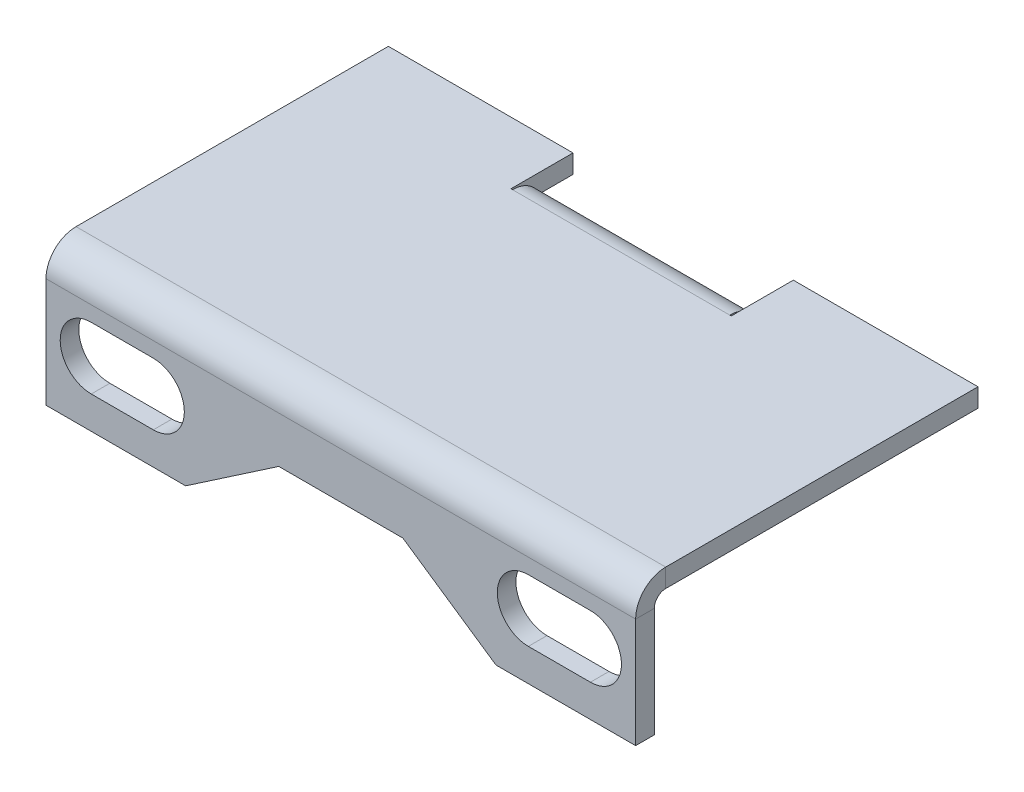
from build123d import *

# Parameters (mm, degrees)
BRIDA_BASE1_DEPTH                = 1.2
BRIDA_DE_ARISTA1_STRIP_W         = 6.2732
BRIDA_DE_ARISTA1_STRIP_H         = 1.2
BRIDA_DE_ARISTA1_STRIP_CUT_DEPTH = 38
BRIDA_DE_ARISTA1_DEPTH           = 38
BRIDA_DE_ARISTA2_STRIP_W         = 6.2732
BRIDA_DE_ARISTA2_STRIP_H         = 1.2
BRIDA_DE_ARISTA2_STRIP_CUT_DEPTH = 38
BRIDA_DE_ARISTA2_DEPTH           = 38
DESDOBLAR1_START                 = -19
DESDOBLAR1_DEPTH                 = 38
DESDOBLAR1_2_DEPTH               = 38
CROQUIS14_W                      = 12
CROQUIS14_H                      = 6.162926371
CORTAR_EXTRUIR1_DEPTH            = 1.2
DOBLAR1_START                    = -19
DOBLAR1_DEPTH                    = 38
DOBLAR1_2_DEPTH                  = 38
DOBLAR1_START_2                  = -7
DOBLAR1_3_DEPTH                  = 14
CROQUIS16_W                      = 11.9
CROQUIS16_H                      = 4
SALIENTE_EXTRUIR1_DEPTH          = 1.2


# Read off the part's stored shape, not the designer's step: Desdoblar1, Doblar1
# Sheet-metal steps are written as plain solids
with BuildPart() as part:
    # Croquis1 → Brida base1 (new body)
    with BuildSketch(Plane.XY):
        Polygon((-19, 19), (19, 19), (19, 10), (10, 10), (4, 14.085), (-4, 14.085), (-10, 10), (-19, 10), align=None)
        with BuildLine():
            Line((-16.085, 16.085), (-12.085, 16.085))
            ThreePointArc((-12.085, 16.085), (-10.085, 14.085), (-12.085, 12.085))
            Line((-12.085, 12.085), (-16.085, 12.085))
            ThreePointArc((-16.085, 12.085), (-18.085, 14.085), (-16.085, 16.085))
        make_face(mode=Mode.SUBTRACT)
        with BuildLine():
            Line((12.085, 16.085), (16.085, 16.085))
            ThreePointArc((16.085, 16.085), (18.085, 14.085), (16.085, 12.085))
            Line((16.085, 12.085), (12.085, 12.085))
            ThreePointArc((12.085, 12.085), (10.085, 14.085), (12.085, 16.085))
        make_face(mode=Mode.SUBTRACT)
    extrude(amount=-BRIDA_BASE1_DEPTH)

    # Brida de arista1 strip (across the edge) → Brida de arista1 strip cut (cut)
    with BuildSketch(Plane(origin=(-19, 19, -1.2), x_dir=(0, -1, 0), z_dir=(1, 0, 0))):
        with Locations((-1.2, -0.6)):
            Rectangle(BRIDA_DE_ARISTA1_STRIP_W, BRIDA_DE_ARISTA1_STRIP_H)
    extrude(amount=BRIDA_DE_ARISTA1_STRIP_CUT_DEPTH, mode=Mode.SUBTRACT)

    # Brida de arista1 section (across the edge) → Brida de arista1 (add)
    with BuildSketch(Plane(origin=(-19, 19, -1.2), x_dir=(0, -1, 0), z_dir=(1, 0, 0))):
        with BuildLine():
            Line((0, 0.7366), (0, 18.8))
            Line((0, 18.8), (1.2, 18.8))
            Line((1.2, 18.8), (1.2, 0.7366))
            ThreePointArc((1.2, 0.7366), (1.415745145, 0.215745145), (1.9366, 0))
            Line((1.9366, 0), (1.9366, -1.2))
            ThreePointArc((1.9366, -1.2), (0.567217008, -0.632782992), (0, 0.7366))
        make_face()
    extrude(amount=BRIDA_DE_ARISTA1_DEPTH)

    # Brida de arista2 strip (across the edge) → Brida de arista2 strip cut (cut)
    with BuildSketch(Plane(origin=(-19, 17.8, -20), x_dir=(0, 0, 1), z_dir=(1, 0, 0))):
        with Locations((-1.2, -0.6)):
            Rectangle(BRIDA_DE_ARISTA2_STRIP_W, BRIDA_DE_ARISTA2_STRIP_H)
    extrude(amount=BRIDA_DE_ARISTA2_STRIP_CUT_DEPTH, mode=Mode.SUBTRACT)

    # Brida de arista2 section (across the edge) → Brida de arista2 (add)
    with BuildSketch(Plane(origin=(-19, 17.8, -20), x_dir=(0, 0, 1), z_dir=(1, 0, 0))):
        with BuildLine():
            Line((0, 0.7366), (0, 4.8))
            Line((0, 4.8), (1.2, 4.8))
            Line((1.2, 4.8), (1.2, 0.7366))
            ThreePointArc((1.2, 0.7366), (1.415745145, 0.215745145), (1.9366, 0))
            Line((1.9366, 0), (1.9366, -1.2))
            ThreePointArc((1.9366, -1.2), (0.567217008, -0.632782992), (0, 0.7366))
        make_face()
    extrude(amount=BRIDA_DE_ARISTA2_DEPTH)

    # Desdoblar1 outline → Desdoblar1 (cut)
    with BuildSketch(Plane.YZ.offset(DESDOBLAR1_START)):
        with BuildLine():
            ThreePointArc((19, -1.9366), (18.963262642, -1.561178238), (18.854444388, -1.2))
            Line((18.854444388, -1.2), (17.0634, -1.2))
            ThreePointArc((17.0634, -1.2), (17.584254855, -1.415745145), (17.8, -1.9366))
            Line((17.8, -1.9366), (17.8, -18.0634))
            ThreePointArc((17.8, -18.0634), (17.584254855, -18.584254855), (17.0634, -18.8))
            Line((17.0634, -18.8), (13, -18.8))
            Line((13, -18.8), (13, -20))
            Line((13, -20), (17.0634, -20))
            ThreePointArc((17.0634, -20), (18.432782992, -19.432782992), (19, -18.0634))
            Line((19, -18.0634), (19, -1.9366))
        make_face()
    extrude(amount=DESDOBLAR1_DEPTH, mode=Mode.SUBTRACT)

    # Desdoblar1 2 outline → Desdoblar1 2 (add)
    with BuildSketch(Plane.YZ.offset(DESDOBLAR1_START)):
        with BuildLine():
            Line((41.452652741, 0), (17.0634, 0))
            ThreePointArc((17.0634, 0), (18.141342484, -0.327730969), (18.854444388, -1.2))
            Line((18.854444388, -1.2), (41.452652741, -1.2))
            Line((41.452652741, -1.2), (41.452652741, 0))
        make_face()
    extrude(amount=DESDOBLAR1_2_DEPTH)

    # Croquis14 → Cortar-Extruir1 (cut)
    with BuildSketch(Plane(origin=(0, 0, -1.2), x_dir=(-1, 0, 0), z_dir=(0, 0, -1))):
        with Locations((13, 38.371189556)):
            Rectangle(CROQUIS14_W, CROQUIS14_H)
        with Locations((-13, 38.371189556)):
            Rectangle(CROQUIS14_W, CROQUIS14_H)
    extrude(amount=-CORTAR_EXTRUIR1_DEPTH, mode=Mode.SUBTRACT)

    # Doblar1 outline → Doblar1 (cut)
    with BuildSketch(Plane.YZ.offset(DOBLAR1_START)):
        with BuildLine():
            ThreePointArc((17.0634, 0), (18.141342484, -0.327730969), (18.854444388, -1.2))
            Line((18.854444388, -1.2), (41.452652741, -1.2))
            Line((41.452652741, -1.2), (41.452652741, 0))
            Line((41.452652741, 0), (17.0634, 0))
        make_face()
    extrude(amount=DOBLAR1_DEPTH, mode=Mode.SUBTRACT)

    # Doblar1 2 outline → Doblar1 2 (add)
    with BuildSketch(Plane.YZ.offset(DOBLAR1_START)):
        with BuildLine():
            Line((19, -18.0634), (19, -1.9366))
            ThreePointArc((19, -1.9366), (18.963262642, -1.561178238), (18.854444388, -1.2))
            Line((18.854444388, -1.2), (17.0634, -1.2))
            ThreePointArc((17.0634, -1.2), (17.584254855, -1.415745145), (17.8, -1.9366))
            Line((17.8, -1.9366), (17.8, -18.0634))
            Line((17.8, -18.0634), (19, -18.0634))
        make_face()
    extrude(amount=DOBLAR1_2_DEPTH)

    # Doblar1 3 outline → Doblar1 3 (add)
    with BuildSketch(Plane.YZ.offset(DOBLAR1_START_2)):
        with BuildLine():
            ThreePointArc((17.0634, -20), (18.432782992, -19.432782992), (19, -18.0634))
            Line((19, -18.0634), (17.8, -18.0634))
            ThreePointArc((17.8, -18.0634), (17.584254855, -18.584254855), (17.0634, -18.8))
            Line((17.0634, -18.8), (13, -18.8))
            Line((13, -18.8), (13, -20))
            Line((13, -20), (17.0634, -20))
        make_face()
    extrude(amount=DOBLAR1_3_DEPTH)

    # Croquis16 → Saliente-Extruir1 (add)
    with BuildSketch(Plane(origin=(0, 19, 0), x_dir=(1, 0, 0), z_dir=(0, 1, 0))):
        with Locations((-13.05, 20.0634)):
            Rectangle(CROQUIS16_W, CROQUIS16_H)
        with Locations((13.05, 20.0634)):
            Rectangle(CROQUIS16_W, CROQUIS16_H)
    extrude(amount=-SALIENTE_EXTRUIR1_DEPTH)


solid = part.part
